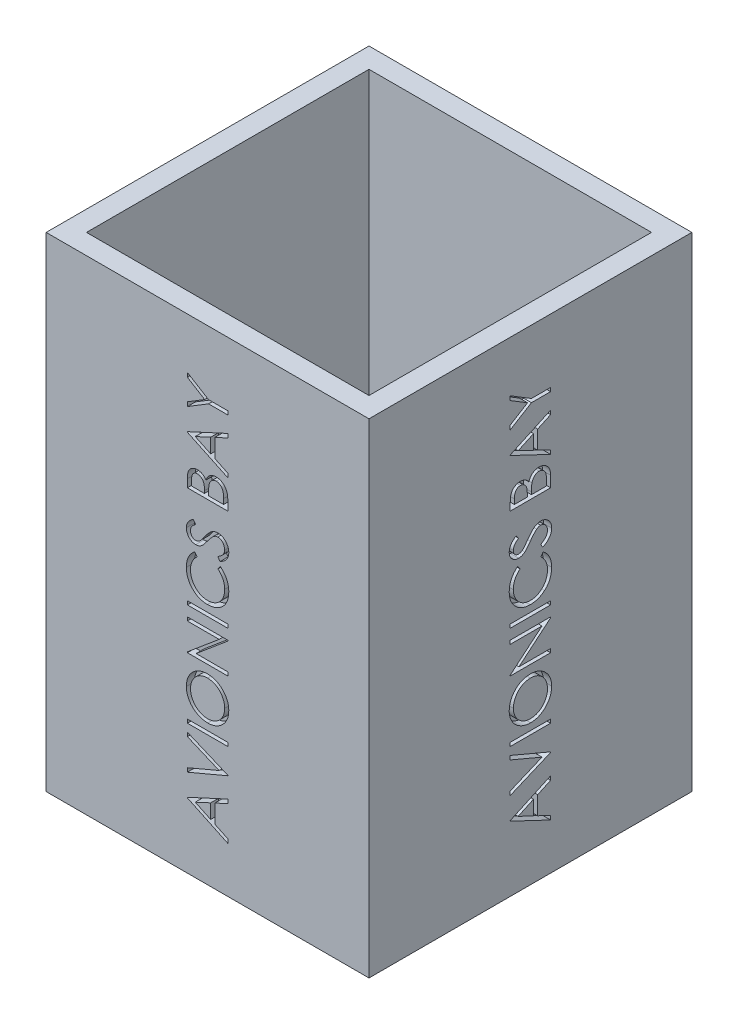
from build123d import *

# Parameters (mm, degrees)
SKETCH1_W           = 101.6
SKETCH1_H           = 101.6
SKETCH1_W_2         = 88.9
SKETCH1_H_2         = 88.9
BOSS_EXTRUDE1_DEPTH = 152.4
SKETCH6_W           = 12.7
SKETCH6_H           = 1.13974359
CUT_EXTRUDE1_DEPTH  = 2.54
CIRPATTERN1_COUNT   = 4


with BuildPart() as part:
    # Sketch1 → Boss-Extrude1 (new body)
    with BuildSketch(Plane(origin=(0, 0, 0), x_dir=(1, 0, 0), z_dir=(0, 1, 0))):
        Rectangle(SKETCH1_W, SKETCH1_H)
        Rectangle(SKETCH1_W_2, SKETCH1_H_2, mode=Mode.SUBTRACT)
    extrude(amount=BOSS_EXTRUDE1_DEPTH)

    # Sketch6 → Cut-Extrude1 (cut)
    # profile 1 of 11: a face of its own
    with BuildSketch(Plane.ZY.offset(50.8)):
        Polygon((-6.35, 20.678205128), (6.35, 26.53974359), (6.35, 25.30078125), (2.279487179, 23.423257212), (2.279487179, 17.666025641), (6.35, 15.735076122), (6.35, 14.491025641), (-6.35, 20.515384615), align=None)
        Polygon((-3.874619391, 20.584074519), (0.976923077, 18.284234776), (0.976923077, 22.822856571), align=None, mode=Mode.SUBTRACT)
    # profile 2 of 11: a face of its own
    with BuildSketch(Plane.ZY.offset(50.8)):
        Polygon((-6.35, 27.516666667), (-6.35, 28.737820513), (3.658373397, 32.971153846), (-6.35, 37.204487179), (-6.35, 38.425641026), (6.35, 33.052564103), (6.35, 32.88974359), align=None)
    # profile 3 of 11: a face of its own
    with BuildSketch(Plane.ZY.offset(50.8)):
        with Locations((0, 41.437820513)):
            Rectangle(SKETCH6_W, SKETCH6_H)
    # profile 4 of 11: a face of its own
    with BuildSketch(Plane.ZY.offset(50.8)):
        with BuildLine():
            add(Edge.make_bspline(
                [(-6.675641026, 50.718589744), (-6.669785071, 50.953776225), (-6.658283492, 51.415701878), (-6.567334124, 52.093959972), (-6.41764098, 52.74342251), (-6.206242297, 53.364462859), (-5.932190469, 53.954719051), (-5.599295982, 54.515858123), (-5.205535771, 55.046198399), (-4.756691829, 55.542089333), (-4.26513446, 55.994456748), (-3.738912975, 56.391411503), (-3.184643364, 56.726280299), (-2.60229672, 57.000406882), (-1.99323266, 57.215614417), (-1.354037691, 57.364081648), (-0.688898346, 57.458928646), (-0.235229152, 57.47001636), (-0.005088141, 57.475641026)],
                knots=[0, 0, 0, 0, 1.065064174, 2.09187391, 3.093564831, 4.079973196, 5.057907931, 6.036227367, 7.030399151, 8.044883615, 9.061699972, 10.052012555, 11.025713132, 11.989727027, 12.962874294, 13.945865945, 14.957962116, 16, 16, 16, 16], degree=3))
            add(Edge.make_bspline(
                [(-0.005088141, 57.475641026), (0.223356266, 57.470014467), (0.673646657, 57.458923867), (1.334584132, 57.364004689), (1.969850898, 57.214951949), (2.578031024, 57.003071444), (3.159194899, 56.728734508), (3.71388411, 56.393372735), (4.241511135, 55.997171355), (4.736454933, 55.546724924), (5.189213913, 55.054231132), (5.588564969, 54.530032068), (5.923579539, 53.975777236), (6.200766497, 53.397210358), (6.411489139, 52.78978834), (6.56490218, 52.157931404), (6.658807614, 51.498196983), (6.669968316, 51.048780089), (6.675641026, 50.820352564)],
                knots=[0, 0, 0, 0, 1.043748596, 2.057349401, 3.045489418, 4.02252776, 4.995289225, 5.97782527, 6.980224157, 8.006516136, 9.032559198, 10.034193337, 11.013412982, 11.987833483, 12.961212594, 13.946489799, 14.956251404, 16, 16, 16, 16], degree=3))
            add(Edge.make_bspline(
                [(6.675641026, 50.820352564), (6.670018965, 50.590212892), (6.658936386, 50.136546337), (6.563935289, 49.470569095), (6.415376844, 48.83093271), (6.203071175, 48.21946635), (5.928688652, 47.635829034), (5.594118477, 47.078879305), (5.19712685, 46.550852685), (4.746579565, 46.056126919), (4.256099934, 45.603465543), (3.730558494, 45.20882438), (3.180265837, 44.874178969), (2.603694821, 44.600717734), (2.003632729, 44.384220981), (1.376076825, 44.236520641), (0.724604903, 44.140958758), (0.281037815, 44.129946601), (0.055969551, 44.124358974)],
                knots=[0, 0, 0, 0, 1.053102029, 2.075944431, 3.073151272, 4.055350789, 5.033113405, 6.020478099, 7.024410459, 8.052272461, 9.079885166, 10.07527673, 11.055994387, 12.023226415, 12.992069828, 13.970394897, 14.97016774, 16, 16, 16, 16], degree=3))
            add(Edge.make_bspline(
                [(0.055969551, 44.124358974), (-0.095097562, 44.126298937), (-0.395326011, 44.13015439), (-0.841156245, 44.17656996), (-1.279816632, 44.243922419), (-1.710059786, 44.340449359), (-2.130832502, 44.466693407), (-2.545036699, 44.615653621), (-2.948474782, 44.797589631), (-3.343057946, 45.003259411), (-3.722635205, 45.2328094), (-4.081426835, 45.486358548), (-4.422443595, 45.755001171), (-4.736848437, 46.049508342), (-5.033787705, 46.360173729), (-5.308698135, 46.692036987), (-5.564058671, 47.043073131), (-5.794183909, 47.414792623), (-6.002315626, 47.798036078), (-6.180920628, 48.193103243), (-6.33421348, 48.594628516), (-6.45845876, 49.004492525), (-6.556546433, 49.421606869), (-6.623338831, 49.846881916), (-6.669872784, 50.279978863), (-6.673710006, 50.571757077), (-6.675641026, 50.718589744)],
                knots=[0, 0, 0, 0, 1.037015668, 2.060948919, 3.074880161, 4.083647147, 5.086022904, 6.090072063, 7.104153813, 8.122640571, 9.144368836, 10.147691507, 11.138137339, 12.123020368, 13.103399296, 14.087645067, 15.080126199, 16.082011238, 17.087798457, 18.072939717, 19.057185487, 20.037253025, 21.01195951, 21.997135196, 22.992090687, 24, 24, 24, 24], degree=3))
        make_face()
        with BuildLine():
            add(Edge.make_bspline(
                [(-5.373076923, 50.774559295), (-5.371612874, 50.654036083), (-5.368698771, 50.41414187), (-5.330103131, 50.057532198), (-5.275488499, 49.705504237), (-5.196168901, 49.358739209), (-5.093572448, 49.016509883), (-4.969833028, 48.678664322), (-4.820275395, 48.346360887), (-4.652079665, 48.02001472), (-4.461036223, 47.707163348), (-4.258166746, 47.407053335), (-4.035933534, 47.127490795), (-3.799142721, 46.864635323), (-3.545739327, 46.619140613), (-3.277387483, 46.391114952), (-2.992926494, 46.180745328), (-2.693527038, 45.99056345), (-2.380860728, 45.821316425), (-2.060904396, 45.669782467), (-1.729897889, 45.544166597), (-1.389906788, 45.444660114), (-1.042429358, 45.360201909), (-0.685572416, 45.307223472), (-0.320566176, 45.268247545), (-0.073887757, 45.265494862), (0.05088141, 45.264102564)],
                knots=[0, 0, 0, 0, 1.008406545, 2.007172654, 2.999155034, 3.989332444, 4.982025741, 5.988181096, 6.998684226, 8.030553839, 9.059268815, 10.065399129, 11.060956322, 12.046057109, 13.024974577, 14.012068307, 14.991706172, 15.984221787, 16.978487447, 17.966117052, 18.945677757, 19.938371053, 20.93015022, 21.936155317, 22.956113857, 24, 24, 24, 24], degree=3))
            add(Edge.make_bspline(
                [(0.05088141, 45.264102564), (0.234345869, 45.268739076), (0.595277215, 45.277860528), (1.124266852, 45.357384132), (1.63314324, 45.480852383), (2.118873279, 45.659858024), (2.583622971, 45.888215042), (3.025583679, 46.166764243), (3.444625029, 46.498056552), (3.837627676, 46.874154181), (4.19619396, 47.285407025), (4.511375607, 47.721887717), (4.776641272, 48.180142983), (4.998397407, 48.657531559), (5.165459253, 49.158129306), (5.284574271, 49.678726583), (5.361776101, 50.219334899), (5.369274234, 50.587728134), (5.373076923, 50.774559295)],
                knots=[0, 0, 0, 0, 1.032022337, 2.030307203, 3.003823408, 3.974715386, 4.937372378, 5.913284036, 6.909147208, 7.938749767, 8.970518239, 9.975863271, 10.963918693, 11.946286286, 12.933361397, 13.927862637, 14.949112547, 16, 16, 16, 16], degree=3))
            add(Edge.make_bspline(
                [(5.373076923, 50.774559295), (5.371352914, 50.900142838), (5.367933685, 51.149212721), (5.333446658, 51.519666375), (5.278253288, 51.883480379), (5.198393676, 52.23998253), (5.099767851, 52.589639923), (4.97743268, 52.931397518), (4.830782133, 53.265141802), (4.667344949, 53.592513872), (4.481684714, 53.906183548), (4.281550104, 54.204473162), (4.063238117, 54.483554059), (3.829627504, 54.746286203), (3.57700307, 54.99006041), (3.310282099, 55.217436835), (3.025217373, 55.424169109), (2.727044186, 55.613706266), (2.416657403, 55.785018365), (2.095821442, 55.932169161), (1.766257055, 56.057838985), (1.427722103, 56.1591431), (1.080978091, 56.238565908), (0.725528754, 56.293281802), (0.362093818, 56.331558287), (0.116280345, 56.334443183), (-0.007632212, 56.335897436)],
                knots=[0, 0, 0, 0, 1.047334373, 2.07717862, 3.100662057, 4.115010574, 5.122652213, 6.129548646, 7.140165612, 8.16200981, 9.179904151, 10.178566626, 11.156366481, 12.133321541, 13.108841334, 14.082538371, 15.054589433, 16.043660176, 17.028268541, 18.009491307, 18.985652105, 19.968123554, 20.954864208, 21.950389976, 22.966808393, 24, 24, 24, 24], degree=3))
            add(Edge.make_bspline(
                [(-0.007632212, 56.335897436), (-0.130697041, 56.334441969), (-0.374818801, 56.331554782), (-0.735719484, 56.293300659), (-1.088609709, 56.238506), (-1.432104078, 56.159538459), (-1.766290161, 56.057756476), (-2.090854054, 55.932253863), (-2.407005009, 55.784261543), (-2.713961172, 55.614414362), (-3.008510573, 55.423494815), (-3.290092515, 55.214870151), (-3.553442649, 54.984954519), (-3.804973342, 54.740256746), (-4.03965346, 54.474893764), (-4.256576238, 54.188819264), (-4.465515493, 53.889156128), (-4.650429047, 53.569127694), (-4.822051388, 53.24003162), (-4.968471586, 52.902031491), (-5.094225799, 52.559954443), (-5.196475173, 52.212432789), (-5.275184667, 51.859630794), (-5.330152005, 51.501753628), (-5.368685515, 51.140050484), (-5.371608475, 50.896776301), (-5.373076923, 50.774559295)],
                knots=[0, 0, 0, 0, 1.029877221, 2.042951179, 3.035109885, 4.018542222, 4.991021277, 5.957494829, 6.929429462, 7.911425532, 8.892163142, 9.866273635, 10.842761649, 11.81676864, 12.802607151, 13.805177466, 14.821356543, 15.858816981, 16.897175917, 17.927346774, 18.940346092, 19.946830556, 20.957962087, 21.964146003, 22.97721996, 24, 24, 24, 24], degree=3))
        make_face(mode=Mode.SUBTRACT)
    # profile 5 of 11: a face of its own
    with BuildSketch(Plane.ZY.offset(50.8)):
        Polygon((6.35, 60.080769231), (-6.35, 60.080769231), (-6.35, 60.319911859), (3.645653045, 68.71025641), (-6.35, 68.71025641), (-6.35, 69.85), (6.35, 69.85), (6.35, 69.590504808), (-3.62275641, 61.220512821), (6.35, 61.220512821), align=None)
    # profile 6 of 11: a face of its own
    with BuildSketch(Plane.ZY.offset(50.8)):
        with Locations((0, 73.676282051)):
            Rectangle(SKETCH6_W, SKETCH6_H)
    # profile 7 of 11: a face of its own
    with BuildSketch(Plane.ZY.offset(50.8)):
        with BuildLine():
            Line((-4.01963141, 88.737179487), (-3.256410256, 87.739903846))
            add(Edge.make_bspline(
                [(-3.256410256, 87.739903846), (-3.341194225, 87.66876175), (-3.509619091, 87.527436708), (-3.746144204, 87.300084035), (-3.96766222, 87.063092265), (-4.175596423, 86.816791141), (-4.361589506, 86.555480687), (-4.540126766, 86.289117567), (-4.696442281, 86.008023627), (-4.887401238, 85.621298238), (-5.082322078, 85.113422851), (-5.249970827, 84.47630071), (-5.355686274, 83.810291597), (-5.36721364, 83.35602053), (-5.373076923, 83.124959936)],
                knots=[0, 0, 0, 0, 0.75789156, 1.505565099, 2.245254514, 2.979266606, 3.711207489, 4.440978832, 5.174393176, 5.91211879, 7.394186119, 8.890401545, 10.418332761, 12, 12, 12, 12], degree=3))
            add(Edge.make_bspline(
                [(-5.373076923, 83.124959936), (-5.371611116, 82.997657678), (-5.368693107, 82.744234648), (-5.330197138, 82.368138759), (-5.276090748, 81.999065687), (-5.195807431, 81.637255511), (-5.094306788, 81.283168771), (-4.973020274, 80.934490642), (-4.822961328, 80.596269264), (-4.657105476, 80.263826165), (-4.469772216, 79.945312206), (-4.265432984, 79.643944011), (-4.046387468, 79.360803099), (-3.811766703, 79.095730062), (-3.562803693, 78.848216165), (-3.296709232, 78.621376006), (-3.01632795, 78.412178829), (-2.721427006, 78.22181689), (-2.414752947, 78.050446937), (-2.09455485, 77.906351454), (-1.766315152, 77.780499435), (-1.427706865, 77.679347067), (-1.080980558, 77.599905176), (-0.72469984, 77.544982709), (-0.359540199, 77.506932881), (-0.112038264, 77.504028246), (0.012720353, 77.502564103)],
                knots=[0, 0, 0, 0, 1.054877232, 2.099964208, 3.13098259, 4.145888998, 5.169474743, 6.183358035, 7.203388855, 8.234598956, 9.261847606, 10.264062591, 11.251197969, 12.227332808, 13.196685059, 14.158975844, 15.123498106, 16.094582253, 17.066912473, 18.032714859, 19.002806091, 19.979168736, 20.95977404, 21.949109834, 22.966205168, 24, 24, 24, 24], degree=3))
            add(Edge.make_bspline(
                [(0.012720353, 77.502564103), (0.200426958, 77.507153439), (0.568963978, 77.516163992), (1.108848166, 77.596015543), (1.62655408, 77.718332475), (2.118576381, 77.898650853), (2.58901667, 78.125429822), (3.032169897, 78.408387446), (3.454528385, 78.737342282), (3.845862858, 79.115668985), (4.203321893, 79.530809638), (4.518103914, 79.976206293), (4.780503276, 80.450767193), (4.998856092, 80.949247901), (5.166701906, 81.475485571), (5.284863161, 82.028533553), (5.361941929, 82.607189083), (5.369321311, 83.002592333), (5.373076923, 83.203826122)],
                knots=[0, 0, 0, 0, 1.029159485, 2.020618137, 2.987588728, 3.942669054, 4.889339625, 5.846988364, 6.821327795, 7.821533711, 8.827683044, 9.822769455, 10.807800696, 11.797391277, 12.803701919, 13.832062008, 14.896664671, 16, 16, 16, 16], degree=3))
            add(Edge.make_bspline(
                [(5.373076923, 83.203826122), (5.366949065, 83.425541593), (5.354887975, 83.86193068), (5.252710128, 84.501894661), (5.087037112, 85.114527297), (4.855178937, 85.699861539), (4.553770606, 86.256247255), (4.188381165, 86.784555137), (3.755534929, 87.285231121), (3.425033292, 87.586298346), (3.256410256, 87.739903846)],
                knots=[0, 0, 0, 0, 1.028121516, 2.023589091, 2.998037872, 3.967518031, 4.937445131, 5.927275754, 6.942489185, 8, 8, 8, 8], degree=3))
            Line((3.256410256, 87.739903846), (4.011999199, 88.737179487))
            add(Edge.make_bspline(
                [(4.011999199, 88.737179487), (4.115549426, 88.656919532), (4.322153882, 88.496784061), (4.613478666, 88.237535279), (4.887251894, 87.964230312), (5.142106353, 87.676166654), (5.379096924, 87.372836575), (5.598352345, 87.05426791), (5.798709025, 86.720732587), (5.982746472, 86.374879839), (6.144785206, 86.015912717), (6.288375195, 85.646991365), (6.407251844, 85.265853771), (6.507808151, 84.875708271), (6.579509323, 84.473031297), (6.636606518, 84.06250367), (6.670480805, 83.640282994), (6.673905521, 83.355682198), (6.675641026, 83.211458333)],
                knots=[0, 0, 0, 0, 0.986911346, 1.969095443, 2.935967484, 3.900112155, 4.865124501, 5.834589912, 6.812044781, 7.795288262, 8.784678562, 9.777857908, 10.776141921, 11.791195789, 12.811324908, 13.855933174, 14.913475973, 16, 16, 16, 16], degree=3))
            add(Edge.make_bspline(
                [(6.675641026, 83.211458333), (6.674690367, 83.074865599), (6.672810557, 82.80477038), (6.642358978, 82.40599491), (6.60081279, 82.017775574), (6.538255743, 81.641221932), (6.464434852, 81.274279108), (6.365479149, 80.920273558), (6.254629316, 80.575721795), (6.124345507, 80.242008102), (5.977329645, 79.91884862), (5.811171703, 79.607285647), (5.627268936, 79.307462478), (5.429675042, 79.016431379), (5.212043118, 78.738491576), (4.977395615, 78.471234498), (4.726523405, 78.213161513), (4.545621508, 78.053494627), (4.454667468, 77.973217147)],
                knots=[0, 0, 0, 0, 1.114604814, 2.203992996, 3.262667896, 4.300477797, 5.318619304, 6.316056647, 7.298880507, 8.271930387, 9.238335007, 10.195173496, 11.151986948, 12.108099108, 13.064862484, 14.031167946, 15.010108607, 16, 16, 16, 16], degree=3))
            add(Edge.make_bspline(
                [(4.454667468, 77.973217147), (4.296671895, 77.844644771), (3.982588209, 77.589052255), (3.473598494, 77.261901295), (2.942643322, 76.982795524), (2.386647308, 76.754609118), (1.80539431, 76.579335337), (1.199819394, 76.456106475), (0.571133136, 76.376587079), (0.143559958, 76.367459908), (-0.073778045, 76.362820513)],
                knots=[0, 0, 0, 0, 0.994611881, 1.977215934, 2.950189954, 3.921972279, 4.908960509, 5.911694611, 6.938501887, 8, 8, 8, 8], degree=3))
            add(Edge.make_bspline(
                [(-0.073778045, 76.362820513), (-0.302216405, 76.368463644), (-0.751654617, 76.379566151), (-1.41123439, 76.473893752), (-2.04315518, 76.625636241), (-2.646237339, 76.841162094), (-3.223652928, 77.11441294), (-3.770991014, 77.451966653), (-4.291751972, 77.849901712), (-4.77803407, 78.305097172), (-5.222676864, 78.804270075), (-5.613859375, 79.338826914), (-5.93940579, 79.907721407), (-6.211534722, 80.504686183), (-6.420701774, 81.13419137), (-6.567126194, 81.794893881), (-6.658265445, 82.485552229), (-6.669786913, 82.956767316), (-6.675641026, 83.19619391)],
                knots=[0, 0, 0, 0, 1.032925535, 2.032216505, 3.007276963, 3.968222605, 4.92396291, 5.891752235, 6.871517503, 7.883894988, 8.900124299, 9.891468569, 10.874487609, 11.85992873, 12.854644235, 13.869047385, 14.917252991, 16, 16, 16, 16], degree=3))
            add(Edge.make_bspline(
                [(-6.675641026, 83.19619391), (-6.673890031, 83.342114516), (-6.670424115, 83.630949658), (-6.636678167, 84.058230506), (-6.580304858, 84.474192872), (-6.5039791, 84.879274223), (-6.407862207, 85.27464568), (-6.288069769, 85.659567565), (-6.145448455, 86.033097302), (-5.982581524, 86.395113545), (-5.799438593, 86.743172484), (-5.598179886, 87.077055612), (-5.379822309, 87.395431829), (-5.142130377, 87.696646351), (-4.887075716, 87.981067708), (-4.617645938, 88.252915028), (-4.326927265, 88.504275096), (-4.12225087, 88.659402575), (-4.01963141, 88.737179487)],
                knots=[0, 0, 0, 0, 1.096622143, 2.170653093, 3.219033441, 4.250379162, 5.267604342, 6.275621678, 7.278284436, 8.271072515, 9.257558938, 10.232633088, 11.19973724, 12.157384997, 13.114417402, 14.069920322, 15.032307892, 16, 16, 16, 16], degree=3))
        make_face()
    # profile 8 of 11: a face of its own
    with BuildSketch(Plane.ZY.offset(50.8)):
        with BuildLine():
            Line((3.900060096, 90.03974359), (3.256410256, 91.113341346))
            add(Edge.make_bspline(
                [(3.256410256, 91.113341346), (3.423558168, 91.213193236), (3.743807115, 91.404505602), (4.176543433, 91.723643391), (4.544343259, 92.054325669), (4.845066949, 92.399001251), (5.081827195, 92.755566263), (5.249475293, 93.1263484), (5.354036118, 93.510098171), (5.366736432, 93.771260323), (5.373076923, 93.901642628)],
                knots=[0, 0, 0, 0, 1.272034388, 2.437168799, 3.508375237, 4.49857839, 5.41946034, 6.295179144, 7.148887113, 8, 8, 8, 8], degree=3))
            add(Edge.make_bspline(
                [(5.373076923, 93.901642628), (5.369901903, 94.012969551), (5.363607418, 94.233675437), (5.305569139, 94.559226871), (5.210618635, 94.873820423), (5.081902947, 95.174328835), (4.923683382, 95.452790602), (4.737112822, 95.700890196), (4.521537218, 95.910383999), (4.284942628, 96.084056896), (4.031233879, 96.218443722), (3.769823052, 96.32001459), (3.497123393, 96.376899748), (3.313472359, 96.38543586), (3.220793269, 96.38974359)],
                knots=[0, 0, 0, 0, 1.09553864, 2.171907928, 3.244545276, 4.325730702, 5.384330216, 6.391480148, 7.371786628, 8.333890167, 9.27165687, 10.191402356, 11.087295184, 12, 12, 12, 12], degree=3))
            add(Edge.make_bspline(
                [(3.220793269, 96.38974359), (3.115018322, 96.384508847), (2.900812519, 96.373907922), (2.584236292, 96.280481264), (2.269594656, 96.137822667), (2.074931876, 96.003739618), (1.974198718, 95.934354968)],
                knots=[0, 0, 0, 0, 0.938992559, 1.901562324, 2.914110574, 4, 4, 4, 4], degree=3))
            add(Edge.make_bspline(
                [(1.974198718, 95.934354968), (1.90144819, 95.877501361), (1.748717556, 95.758144324), (1.521566328, 95.552774984), (1.286785255, 95.313014926), (1.03922007, 95.042145649), (0.780927013, 94.73971279), (0.5098905, 94.405599338), (0.231649187, 94.036953825), (0.045281334, 93.778202783), (-0.05088141, 93.644691506)],
                knots=[0, 0, 0, 0, 0.72225051, 1.516274602, 2.393638633, 3.3469932, 4.386926276, 5.505032946, 6.712638081, 8, 8, 8, 8], degree=3))
            add(Edge.make_bspline(
                [(-0.05088141, 93.644691506), (-0.146053714, 93.511073006), (-0.328015911, 93.255604608), (-0.598069742, 92.898340609), (-0.844971783, 92.578864986), (-1.071046341, 92.298597698), (-1.276324078, 92.057662018), (-1.458833743, 91.854159355), (-1.623511235, 91.693273734), (-1.730341247, 91.603809198), (-1.778305288, 91.563641827)],
                knots=[0, 0, 0, 0, 1.452282411, 2.77665338, 3.964542531, 5.026858415, 5.96415736, 6.766646006, 7.446254459, 8, 8, 8, 8], degree=3))
            add(Edge.make_bspline(
                [(-1.778305288, 91.563641827), (-1.853061333, 91.507508002), (-2.000079127, 91.3971133), (-2.229805018, 91.251233986), (-2.464519473, 91.128213563), (-2.705073148, 91.029205123), (-2.949658139, 90.949140748), (-3.200110695, 90.893475469), (-3.454730594, 90.859164567), (-3.626042223, 90.855620349), (-3.711798878, 90.853846154)],
                knots=[0, 0, 0, 0, 1.068019517, 2.100403715, 3.106014851, 4.09224787, 5.069873182, 6.043214339, 7.020455327, 8, 8, 8, 8], degree=3))
            add(Edge.make_bspline(
                [(-3.711798878, 90.853846154), (-3.846164323, 90.858581987), (-4.112023245, 90.867952428), (-4.500388447, 90.947205364), (-4.871193366, 91.072281321), (-5.220681509, 91.24756559), (-5.540071901, 91.473310696), (-5.832239357, 91.735689886), (-6.081208535, 92.045304478), (-6.295348186, 92.388070847), (-6.464690808, 92.761284292), (-6.587413997, 93.154196894), (-6.660310029, 93.56398427), (-6.670480481, 93.841990806), (-6.675641026, 93.983052885)],
                knots=[0, 0, 0, 0, 1.005248779, 1.989011071, 2.95484373, 3.928844559, 4.904706341, 5.875556129, 6.859318422, 7.868909462, 8.894684146, 9.918924798, 10.944050749, 12, 12, 12, 12], degree=3))
            add(Edge.make_bspline(
                [(-6.675641026, 93.983052885), (-6.670549285, 94.132734281), (-6.660423439, 94.430402805), (-6.570190732, 94.867557559), (-6.426581296, 95.290168611), (-6.258089803, 95.628624484), (-6.090878214, 95.894077708), (-5.938243775, 96.096316487), (-5.762888377, 96.302369213), (-5.561115259, 96.510021438), (-5.336960086, 96.72132312), (-5.088525366, 96.935300953), (-4.818049902, 97.153957403), (-4.624912741, 97.294577906), (-4.525901442, 97.366666667)],
                knots=[0, 0, 0, 0, 1.286507425, 2.558452658, 3.822738219, 5.118007103, 5.800084425, 6.519418873, 7.295692132, 8.12638276, 9.008892966, 9.945018126, 10.946518512, 12, 12, 12, 12], degree=3))
            Line((-4.525901442, 97.366666667), (-3.744871795, 96.336318109))
            add(Edge.make_bspline(
                [(-3.744871795, 96.336318109), (-3.825026824, 96.274107404), (-3.97938667, 96.154304132), (-4.195483741, 95.972345372), (-4.393146913, 95.801104738), (-4.564381231, 95.63110024), (-4.722009393, 95.475435779), (-4.854569572, 95.321670798), (-4.966250039, 95.175739107), (-5.085651319, 94.992234038), (-5.200429634, 94.759775153), (-5.301248892, 94.47040125), (-5.361060256, 94.166971662), (-5.369038173, 93.960416239), (-5.373076923, 93.855849359)],
                knots=[0, 0, 0, 0, 1.181392137, 2.275085037, 3.289537922, 4.225335853, 5.084247276, 5.86831218, 6.587234301, 7.222706459, 8.415108401, 9.595592188, 10.782789524, 12, 12, 12, 12], degree=3))
            add(Edge.make_bspline(
                [(-5.373076923, 93.855849359), (-5.368752177, 93.724621874), (-5.360412313, 93.471562032), (-5.2669317, 93.11312815), (-5.124800726, 92.788656041), (-4.919849343, 92.510532372), (-4.675507819, 92.280889971), (-4.396853518, 92.112714045), (-4.089090687, 92.012164614), (-3.874507915, 91.999857539), (-3.765224359, 91.993589744)],
                knots=[0, 0, 0, 0, 1.144248881, 2.206576175, 3.214949548, 4.222996039, 5.203671638, 6.127710127, 7.046472867, 8, 8, 8, 8], degree=3))
            add(Edge.make_bspline(
                [(-3.765224359, 91.993589744), (-3.697198882, 91.995097723), (-3.560200307, 91.998134688), (-3.358759769, 92.036942195), (-3.158381362, 92.089413133), (-2.959770314, 92.169853596), (-2.75842921, 92.281873603), (-2.551514272, 92.428819859), (-2.337243251, 92.613934503), (-2.197879003, 92.755726853), (-2.124298878, 92.830588942)],
                knots=[0, 0, 0, 0, 0.858259122, 1.72847414, 2.583651051, 3.473048463, 4.427392529, 5.488649985, 6.674082839, 8, 8, 8, 8], degree=3))
            add(Edge.make_bspline(
                [(-2.124298878, 92.830588942), (-2.099490242, 92.858388779), (-2.0405506, 92.924434829), (-1.94405861, 93.045178902), (-1.825031408, 93.204628484), (-1.677757431, 93.3986199), (-1.506918983, 93.630730041), (-1.314700447, 93.90098443), (-1.094861782, 94.206370564), (-0.94116442, 94.423075802), (-0.859895833, 94.537660256)],
                knots=[0, 0, 0, 0, 0.420754252, 0.999615792, 1.744751191, 2.668019286, 3.750313428, 4.999500688, 6.413464383, 8, 8, 8, 8], degree=3))
            add(Edge.make_bspline(
                [(-0.859895833, 94.537660256), (-0.759597115, 94.675494759), (-0.565382548, 94.942392169), (-0.273589467, 95.322150989), (0.011792861, 95.666475445), (0.28892344, 95.976599914), (0.555762092, 96.255502879), (0.81531225, 96.500372837), (1.06587182, 96.712320821), (1.384920328, 96.943614136), (1.780392633, 97.17715182), (2.265139205, 97.377391189), (2.751276848, 97.504780047), (3.077597552, 97.521324346), (3.238601763, 97.529487179)],
                knots=[0, 0, 0, 0, 1.163604038, 2.253157948, 3.268574773, 4.215621239, 5.091738613, 5.902582348, 6.650434646, 7.330118262, 8.591011492, 9.77460283, 10.902005569, 12, 12, 12, 12], degree=3))
            add(Edge.make_bspline(
                [(3.238601763, 97.529487179), (3.352459196, 97.527100276), (3.577963027, 97.522372823), (3.909106131, 97.468121419), (4.230644343, 97.388452913), (4.538285192, 97.269341873), (4.836964858, 97.121591781), (5.121056797, 96.936798957), (5.396080303, 96.721480341), (5.654325039, 96.474610946), (5.891685225, 96.204617397), (6.10195552, 95.918225682), (6.281317767, 95.618425471), (6.424162208, 95.301970131), (6.536635166, 94.97225923), (6.617899266, 94.628205505), (6.667829828, 94.269460435), (6.673008226, 94.02561731), (6.675641026, 93.901642628)],
                knots=[0, 0, 0, 0, 0.983922938, 1.948738757, 2.895227473, 3.844781104, 4.796118043, 5.772795661, 6.770647148, 7.813532943, 8.8582745, 9.876489951, 10.882905461, 11.874265028, 12.874055871, 13.891769171, 14.928133632, 16, 16, 16, 16], degree=3))
            add(Edge.make_bspline(
                [(6.675641026, 93.901642628), (6.673786166, 93.805720098), (6.670099808, 93.615083084), (6.637510594, 93.333108674), (6.591401949, 93.05683075), (6.518198939, 92.789716018), (6.429382315, 92.528323317), (6.320023842, 92.27378834), (6.188967649, 92.025992125), (6.039134719, 91.783529184), (5.864718678, 91.547081161), (5.661754709, 91.318609428), (5.435418335, 91.092103531), (5.182213046, 90.869170227), (4.899354459, 90.654673217), (4.591055869, 90.443463115), (4.256400464, 90.236569246), (4.021058782, 90.106577572), (3.900060096, 90.03974359)],
                knots=[0, 0, 0, 0, 0.915313873, 1.819100311, 2.706792138, 3.586475221, 4.459428225, 5.3405999, 6.2277379, 7.133009489, 8.059106158, 9.028520402, 10.047404263, 11.114294124, 12.246039232, 13.433834781, 14.680630578, 16, 16, 16, 16], degree=3))
        make_face()
    # profile 9 of 11: a face of its own
    with BuildSketch(Plane.ZY.offset(50.8)):
        with BuildLine():
            Line((-6.35, 105.019230769), (-6.35, 107.497155449))
            add(Edge.make_bspline(
                [(-6.35, 107.497155449), (-6.349372317, 107.618454983), (-6.34815571, 107.853563668), (-6.32884905, 108.195419645), (-6.303182672, 108.515726817), (-6.260128703, 108.81391916), (-6.215487417, 109.091936968), (-6.149964695, 109.346957777), (-6.077592462, 109.581117702), (-5.966237959, 109.862295843), (-5.793303013, 110.181330972), (-5.536824054, 110.524234041), (-5.229326494, 110.82230631), (-4.878908769, 111.075756093), (-4.493409562, 111.279154935), (-4.081123013, 111.424443424), (-3.64898535, 111.517782282), (-3.352715027, 111.527260927), (-3.202984776, 111.532051282)],
                knots=[0, 0, 0, 0, 1.00128172, 1.940733171, 2.826250472, 3.653024905, 4.427672124, 5.149348099, 5.824709082, 6.450061444, 7.643590664, 8.808605388, 9.972104426, 11.165284501, 12.367876273, 13.557044126, 14.765369432, 16, 16, 16, 16], degree=3))
            add(Edge.make_bspline(
                [(-3.202984776, 111.532051282), (-3.062737383, 111.528061266), (-2.787138031, 111.520220508), (-2.384737295, 111.446157844), (-2.002077719, 111.328609812), (-1.639486801, 111.166153689), (-1.303714203, 110.956838065), (-0.995800058, 110.706048525), (-0.727381826, 110.404726897), (-0.577377362, 110.178855189), (-0.501181891, 110.064122596)],
                knots=[0, 0, 0, 0, 1.044641374, 2.052818814, 3.038628718, 4.023282556, 5.005660861, 5.98021751, 6.974042014, 8, 8, 8, 8], degree=3))
            add(Edge.make_bspline(
                [(-0.501181891, 110.064122596), (-0.445773816, 110.208382216), (-0.339764444, 110.484386606), (-0.152634166, 110.864428018), (0.051636421, 111.190663756), (0.271263785, 111.46946667), (0.511490195, 111.706655781), (0.774267381, 111.912075266), (1.059380217, 112.089664414), (1.365780824, 112.24079155), (1.690871704, 112.3595038), (2.030682193, 112.446755659), (2.383909628, 112.49836703), (2.623616838, 112.505407612), (2.745052083, 112.508974359)],
                knots=[0, 0, 0, 0, 1.272586185, 2.434772614, 3.483318042, 4.437947805, 5.351807173, 6.25737843, 7.180033415, 8.1141739, 9.066731021, 10.025721652, 10.999834114, 12, 12, 12, 12], degree=3))
            add(Edge.make_bspline(
                [(2.745052083, 112.508974359), (2.869029524, 112.505430578), (3.112958611, 112.49845809), (3.471291465, 112.446993984), (3.813764183, 112.359915894), (4.142434121, 112.239765244), (4.456612174, 112.084030002), (4.755160179, 111.891766128), (5.038699261, 111.665672621), (5.307729832, 111.410150413), (5.553901262, 111.125390902), (5.765525674, 110.811567593), (5.947492508, 110.477277716), (6.095643415, 110.118247692), (6.209941742, 109.735394053), (6.289576238, 109.328929837), (6.343323875, 108.899524432), (6.347736865, 108.604846892), (6.35, 108.453725962)],
                knots=[0, 0, 0, 0, 0.978680899, 1.925582087, 2.851223405, 3.764209995, 4.683484765, 5.614004905, 6.562443559, 7.542772147, 8.539900013, 9.527881485, 10.525548727, 11.540192123, 12.58875426, 13.674701727, 14.807505862, 16, 16, 16, 16], degree=3))
            Line((6.35, 108.453725962), (6.35, 105.019230769))
            Line((6.35, 105.019230769), (-6.35, 105.019230769))
        make_face()
        with BuildLine():
            Line((-5.047435897, 106.158974359), (-0.976923077, 106.158974359))
            Line((-0.976923077, 106.158974359), (-0.976923077, 106.924739583))
            add(Edge.make_bspline(
                [(-0.976923077, 106.924739583), (-0.978374226, 107.036676641), (-0.981178141, 107.252961848), (-0.989210049, 107.566179755), (-1.011700083, 107.856919118), (-1.034183694, 108.124678018), (-1.070739951, 108.369035007), (-1.114254566, 108.589448052), (-1.160274294, 108.789378525), (-1.238545357, 109.019930907), (-1.354184303, 109.281489371), (-1.533820739, 109.560139099), (-1.747610778, 109.806932087), (-1.996602328, 110.012835745), (-2.267797908, 110.182839956), (-2.558816675, 110.301933252), (-2.863802254, 110.381329207), (-3.073579537, 110.388610711), (-3.180088141, 110.392307692)],
                knots=[0, 0, 0, 0, 1.156917035, 2.235399477, 3.236897345, 4.169954739, 5.01148057, 5.788325709, 6.491867502, 7.129259015, 8.302032419, 9.437271567, 10.542795419, 11.662606952, 12.764338259, 13.836858145, 14.901724648, 16, 16, 16, 16], degree=3))
            add(Edge.make_bspline(
                [(-3.180088141, 110.392307692), (-3.250585181, 110.390430592), (-3.388872822, 110.386748455), (-3.591119209, 110.355496211), (-3.781156629, 110.304859278), (-3.960808966, 110.236283222), (-4.125611427, 110.142598152), (-4.283438701, 110.034004849), (-4.424837705, 109.899930997), (-4.556615938, 109.748415641), (-4.674557016, 109.57505505), (-4.77225292, 109.376114166), (-4.860797869, 109.156735914), (-4.926345062, 108.910968444), (-4.983983541, 108.64390414), (-5.020198184, 108.351926853), (-5.043502651, 108.036886782), (-5.046095572, 107.818603582), (-5.047435897, 107.705769231)],
                knots=[0, 0, 0, 0, 0.911708768, 1.788416306, 2.640049961, 3.452993646, 4.268229297, 5.087074648, 5.92553149, 6.781184137, 7.681934069, 8.628939405, 9.643570426, 10.73771997, 11.914765019, 13.176320755, 14.540391495, 16, 16, 16, 16], degree=3))
            Line((-5.047435897, 107.705769231), (-5.047435897, 106.158974359))
        make_face(mode=Mode.SUBTRACT)
        with BuildLine():
            Line((0.325641026, 106.158974359), (5.047435897, 106.158974359))
            Line((5.047435897, 106.158974359), (5.047435897, 107.782091346))
            add(Edge.make_bspline(
                [(5.047435897, 107.782091346), (5.045904986, 107.898262155), (5.042954355, 108.122166073), (5.036034513, 108.445699445), (5.009857802, 108.744782361), (4.985709904, 109.020358318), (4.944418036, 109.271695937), (4.905449249, 109.500728521), (4.847602867, 109.703696342), (4.768099821, 109.941215651), (4.640825315, 110.206707339), (4.454878463, 110.496841966), (4.225391341, 110.749834864), (3.964393202, 110.96700565), (3.681391572, 111.146224413), (3.380086158, 111.274830829), (3.066336778, 111.354751442), (2.852362575, 111.364394611), (2.745052083, 111.369230769)],
                knots=[0, 0, 0, 0, 1.160376723, 2.23647316, 3.230273494, 4.158083346, 4.997711197, 5.773399541, 6.476071462, 7.102777513, 8.27340052, 9.405620712, 10.53304798, 11.669441455, 12.787990954, 13.865552736, 14.929550474, 16, 16, 16, 16], degree=3))
            add(Edge.make_bspline(
                [(2.745052083, 111.369230769), (2.677946231, 111.368231973), (2.54481695, 111.366250491), (2.34920062, 111.336231529), (2.159617461, 111.292803605), (1.975277451, 111.235607779), (1.799280024, 111.155651098), (1.630950229, 111.057630908), (1.466897116, 110.945429385), (1.256812893, 110.772323658), (1.01776619, 110.516863765), (0.786615655, 110.15382675), (0.597190031, 109.743319967), (0.517108985, 109.444887606), (0.475741186, 109.29072516)],
                knots=[0, 0, 0, 0, 0.723302347, 1.434937762, 2.129609326, 2.821140842, 3.513216847, 4.209993937, 4.920569932, 5.655069131, 7.14393391, 8.6716197, 10.280644748, 12, 12, 12, 12], degree=3))
            add(Edge.make_bspline(
                [(0.475741186, 109.29072516), (0.463204167, 109.22893387), (0.436021324, 109.094957606), (0.407327657, 108.8764901), (0.381764154, 108.62707709), (0.362855097, 108.34614265), (0.343309639, 108.03333134), (0.33570843, 107.687975093), (0.326639687, 107.311484265), (0.325982428, 107.0502548), (0.325641026, 106.914563301)],
                knots=[0, 0, 0, 0, 0.634451884, 1.375622551, 2.216452059, 3.157844607, 4.20941857, 5.370758133, 6.634282058, 8, 8, 8, 8], degree=3))
            Line((0.325641026, 106.914563301), (0.325641026, 106.158974359))
        make_face(mode=Mode.SUBTRACT)
    # profile 10 of 11: a face of its own
    with BuildSketch(Plane.ZY.offset(50.8)):
        Polygon((-6.35, 120.324358974), (6.35, 126.185897436), (6.35, 124.946935096), (2.279487179, 123.069411058), (2.279487179, 117.312179487), (6.35, 115.381229968), (6.35, 114.137179487), (-6.35, 120.161538462), align=None)
        Polygon((-3.874619391, 120.230228365), (0.976923077, 117.930388622), (0.976923077, 122.469010417), align=None, mode=Mode.SUBTRACT)
    # profile 11 of 11: a face of its own
    with BuildSketch(Plane.ZY.offset(50.8)):
        Polygon((-6.35, 127.162820513), (-6.35, 128.467928686), (-0.89296875, 131.805749199), (-6.35, 135.138481571), (-6.35, 136.443589744), (0.312920673, 132.373076923), (6.35, 132.373076923), (6.35, 131.233333333), (0.312920673, 131.233333333), align=None)
    cut_extrude1 = extrude(amount=-CUT_EXTRUDE1_DEPTH, mode=Mode.SUBTRACT)

    # CirPattern1: Cut-Extrude1 ×4 about axis
    cirpattern1_axis = Axis((0, 0, 0), (0, 1, 0))
    for i in range(1, CIRPATTERN1_COUNT):
        add(cut_extrude1.rotate(cirpattern1_axis, i * 360 / CIRPATTERN1_COUNT), mode=Mode.SUBTRACT)


solid = part.part
